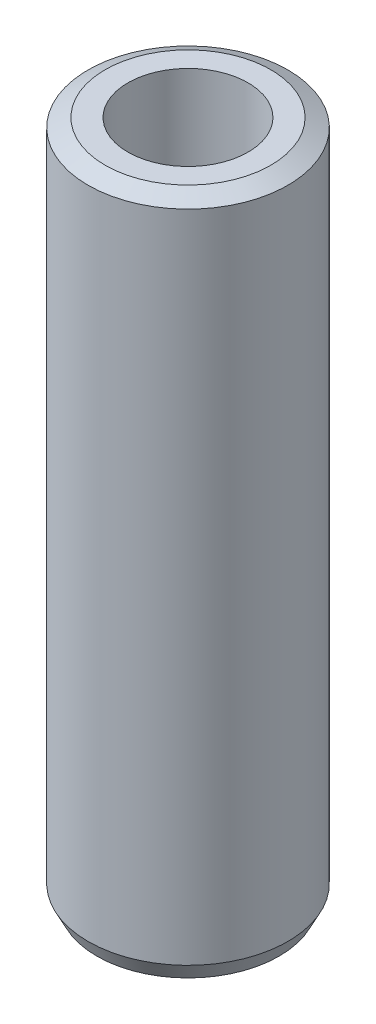
from build123d import *
from OCP.BRepFilletAPI import BRepFilletAPI_MakeChamfer

# Parameters (mm, degrees)
SKETCH1_R           = 42.5
BOSS_EXTRUDE1_DEPTH = 289.523709409
SKETCH2_R           = 25.555625376
CUT_EXTRUDE1_DEPTH  = 296.696598408
CHAMFER1_SIZE       = 3.718440463
CHAMFER1_SIZE2      = 7.277642638


with BuildPart() as part:
    # Sketch1 → Boss-Extrude1 (new body)
    with BuildSketch(Plane(origin=(0, 0, 0), x_dir=(1, 0, 0), z_dir=(0, 1, 0))):
        Circle(SKETCH1_R)
    extrude(amount=BOSS_EXTRUDE1_DEPTH)

    # Sketch2 → Cut-Extrude1 (cut, through all)
    with BuildSketch(Plane(origin=(0, 0, 0), x_dir=(1, 0, 0), z_dir=(0, 1, 0))):
        Circle(SKETCH2_R)
    extrude(amount=CUT_EXTRUDE1_DEPTH, mode=Mode.SUBTRACT)

    # Chamfer1: one chamfer whose edges measure the first distance from different faces: ONE call of the kernel's chamfer builder (chamfer() names one face for all edges)
    chamfer1_edges_1 = [part.edges().sort_by_distance(p)[0] for p in [
        (-42.5, 289.523709409, 0),
    ]]
    chamfer1_side_1 = [part.faces().sort_by_distance(p)[0] for p in [
        (-42.5, 144.761854704, 0),
    ]]
    chamfer1_edges_2 = [part.edges().sort_by_distance(p)[0] for p in [
        (-42.5, 0, 0),
    ]]
    chamfer1_side_2 = [part.faces().sort_by_distance(p)[0] for p in [
        (-41.297918472, 0, 0),
    ]]
    chamfer1 = BRepFilletAPI_MakeChamfer(part.part.solid().wrapped)
    for e in chamfer1_edges_1:
        chamfer1.Add(CHAMFER1_SIZE, CHAMFER1_SIZE2, e.wrapped, chamfer1_side_1[0].wrapped)  # the first distance lies on this face
    for e in chamfer1_edges_2:
        chamfer1.Add(CHAMFER1_SIZE, CHAMFER1_SIZE2, e.wrapped, chamfer1_side_2[0].wrapped)  # the first distance lies on this face
    add(Compound.cast(chamfer1.Shape()), mode=Mode.REPLACE)


solid = part.part
